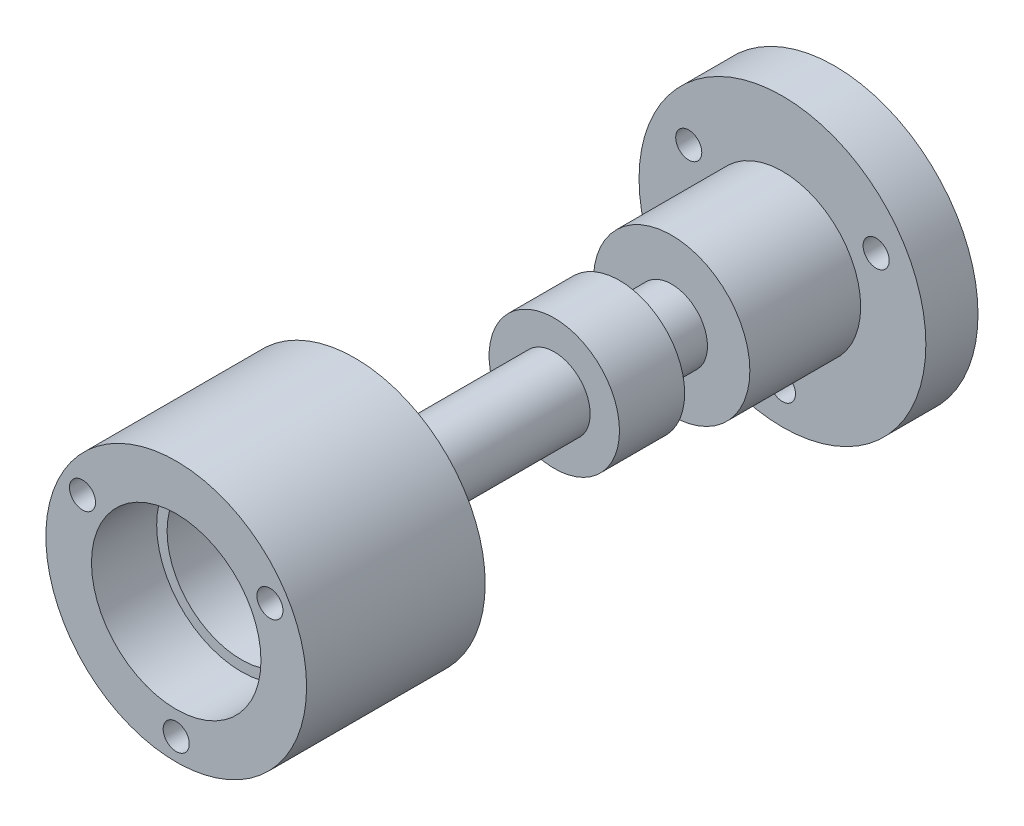
from build123d import *

# Parameters (mm, degrees)
MOUNTING_FLANGE_START                          = -4
SKETCH1_R                                      = 11
MOUNTING_FLANGE_DEPTH                          = 4
SKETCH2_R                                      = 2.75
D5P5_CENTRAL_POST_DEPTH                        = 32.81
CLOSED_FLOOR_BELOW_SHAFT_NOSE_START            = 32.8
SKETCH3_R                                      = 10
CLOSED_FLOOR_BELOW_SHAFT_NOSE_DEPTH            = 2.2
SHAFT_AND_CLIP_CLEARANCE_START                 = 35
SKETCH4_R                                      = 10
SKETCH4_R_2                                    = 5.7
SHAFT_AND_CLIP_CLEARANCE_DEPTH                 = 6.5
LOWER_686ZZ_SEAT_START                         = 41.5
SKETCH5_R                                      = 10
SKETCH5_R_2                                    = 6.5
LOWER_686ZZ_SEAT_DEPTH                         = 5
SKETCH6_R                                      = 1
BASE_THREE_M2_THROUGH_THREAD_MAJOR_ENVEL_DEPTH = 4.01
TOP_CAP_THREE_M2_BLIND_THREAD_MAJOR_ENVE_START = -4.3
SKETCH7_R                                      = 1
TOP_CAP_THREE_M2_BLIND_THREAD_MAJOR_ENVE_DEPTH = 4.3
SKETCH8_R                                      = 6
BENCH_D12_ROOT_TO8P5_DEPTH                     = 8.5
BENCH_D10_MID_COLLAR_12P5_TO17P5_START         = 12.5
SKETCH9_R                                      = 5
BENCH_D10_MID_COLLAR_12P5_TO17P5_DEPTH         = 5


with BuildPart() as part:
    # Sketch1 → Mounting_Flange (new body)
    with BuildSketch(Plane.XY.offset(MOUNTING_FLANGE_START)):
        Circle(SKETCH1_R)
    extrude(amount=MOUNTING_FLANGE_DEPTH)

    # Sketch2 → D5p5_Central_Post (add)
    with BuildSketch(Plane.XY):
        Circle(SKETCH2_R)
    extrude(amount=D5P5_CENTRAL_POST_DEPTH)

    # Sketch3 → Closed_Floor_Below_Shaft_Nose (add)
    with BuildSketch(Plane.XY.offset(CLOSED_FLOOR_BELOW_SHAFT_NOSE_START)):
        Circle(SKETCH3_R)
    extrude(amount=CLOSED_FLOOR_BELOW_SHAFT_NOSE_DEPTH)

    # Sketch4 → Shaft_And_Clip_Clearance (add)
    with BuildSketch(Plane.XY.offset(SHAFT_AND_CLIP_CLEARANCE_START)):
        Circle(SKETCH4_R)
        Circle(SKETCH4_R_2, mode=Mode.SUBTRACT)
    extrude(amount=SHAFT_AND_CLIP_CLEARANCE_DEPTH)

    # Sketch5 → Lower_686ZZ_Seat (add)
    with BuildSketch(Plane.XY.offset(LOWER_686ZZ_SEAT_START)):
        Circle(SKETCH5_R)
        Circle(SKETCH5_R_2, mode=Mode.SUBTRACT)
    extrude(amount=LOWER_686ZZ_SEAT_DEPTH)

    # Sketch6 → Base_Three_M2_Through_Thread_Major_Envelopes (cut)
    with BuildSketch(Plane(origin=(0, 0, -4), x_dir=(-1, 0, 0), z_dir=(0, 0, -1))):
        with Locations((-7.188010851, 4.15)):
            Circle(SKETCH6_R)
        with Locations((7.188010851, 4.15)):
            Circle(SKETCH6_R)
        with Locations((0, -8.3)):
            Circle(SKETCH6_R)
    extrude(amount=-BASE_THREE_M2_THROUGH_THREAD_MAJOR_ENVEL_DEPTH, mode=Mode.SUBTRACT)

    # Sketch7 → Top_Cap_Three_M2_Blind_Thread_Major_Envelopes (cut)
    with BuildSketch(Plane.XY.offset(46.5).offset(TOP_CAP_THREE_M2_BLIND_THREAD_MAJOR_ENVE_START)):
        with Locations((7.188010851, 4.15)):
            Circle(SKETCH7_R)
        with Locations((-7.188010851, 4.15)):
            Circle(SKETCH7_R)
        with Locations((0, -8.3)):
            Circle(SKETCH7_R)
    extrude(amount=TOP_CAP_THREE_M2_BLIND_THREAD_MAJOR_ENVE_DEPTH, mode=Mode.SUBTRACT)

    # Sketch8 → Bench_D12_Root_To8p5 (add)
    with BuildSketch(Plane.XY):
        Circle(SKETCH8_R)
    extrude(amount=BENCH_D12_ROOT_TO8P5_DEPTH)

    # Sketch9 → Bench_D10_Mid_Collar_12p5_To17p5 (add)
    with BuildSketch(Plane.XY.offset(BENCH_D10_MID_COLLAR_12P5_TO17P5_START)):
        Circle(SKETCH9_R)
    extrude(amount=BENCH_D10_MID_COLLAR_12P5_TO17P5_DEPTH)


solid = part.part
